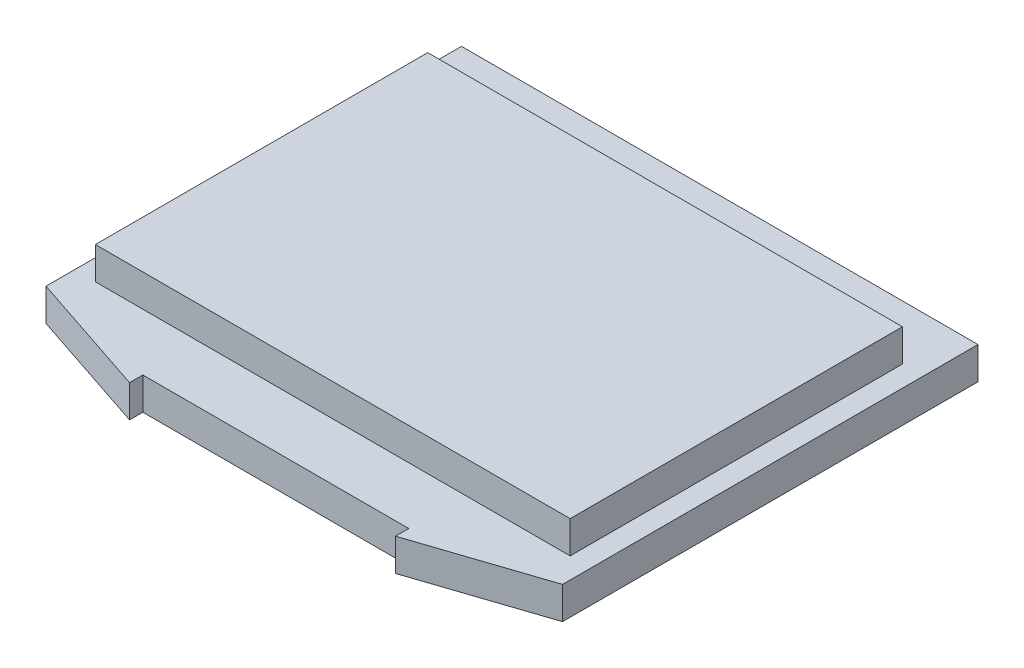
from build123d import *

# Parameters (mm, degrees)
BOSS_EXTRUDE1_DEPTH = 1.7
SKETCH2_W           = 25
SKETCH2_H           = 17.5
BOSS_EXTRUDE2_DEPTH = 1.7
CHAMFER1_SIZE       = 12
CHAMFER1_SIZE_2     = 4
CHAMFER2_SIZE       = 4
CHAMFER2_SIZE_2     = 12
SKETCH3_W           = 27.2
SKETCH3_H           = 2.622019417
CUT_EXTRUDE1_DEPTH  = 20.771507277


with BuildPart() as part:
    # Sketch1 → Boss-Extrude1 (new body)
    with BuildSketch(Plane(origin=(0, 0, 0), x_dir=(1, 0, 0), z_dir=(0, 1, 0))):
        Polygon((-13.6, -14.25), (-7, -14.25), (-7, -11.75), (7, -11.75), (7, -14.25), (13.6, -14.25), (13.6, 14.25), (-13.6, 14.25), align=None)
    extrude(amount=BOSS_EXTRUDE1_DEPTH)

    # Sketch2 → Boss-Extrude2 (add)
    with BuildSketch(Plane(origin=(0, 1.7, 0), x_dir=(1, 0, 0), z_dir=(0, 1, 0))):
        Rectangle(SKETCH2_W, SKETCH2_H)
    extrude(amount=BOSS_EXTRUDE2_DEPTH)

    # Chamfer1
    # the kernel refuses this chamfer: 12, 4 mm, written as the material it takes off along each edge
    with BuildSketch(Plane(origin=(-13.6, -31.140732128, 14.25), x_dir=(0.9999257509361694, 0, 0.012185754582199854), z_dir=(0, 1, 0))) as chamfer1_piece_1:
        Polygon((CHAMFER1_SIZE * 0.999925750936, CHAMFER1_SIZE * 0.0121857545822), (-CHAMFER1_SIZE_2 * 0.0121857545822, CHAMFER1_SIZE_2 * 0.999925750936), (0, 0), align=None)
    extrude(amount=63.981464256, mode=Mode.SUBTRACT)

    # Chamfer2
    # the kernel refuses this chamfer: 12, 4 mm, written as the material it takes off along each edge
    with BuildSketch(Plane(origin=(13.6, -31.140732128, 14.25), x_dir=(0.10902612017980688, 0, -0.9940388851139268), z_dir=(0, 1, 0))) as chamfer2_piece_1:
        Polygon((CHAMFER2_SIZE * 0.994038885114, CHAMFER2_SIZE * 0.10902612018), (-CHAMFER2_SIZE_2 * 0.10902612018, CHAMFER2_SIZE_2 * 0.994038885114), (0, 0), align=None)
    extrude(amount=63.981464256, mode=Mode.SUBTRACT)

    # Sketch3 → Cut-Extrude1 (cut, through all)
    with BuildSketch(Plane(origin=(0, 1.7, 0), x_dir=(1, 0, 0), z_dir=(0, 1, 0))):
        with Locations((0, 12.938990292)):
            Rectangle(SKETCH3_W, SKETCH3_H)
    extrude(amount=-CUT_EXTRUDE1_DEPTH, mode=Mode.SUBTRACT)


solid = part.part
